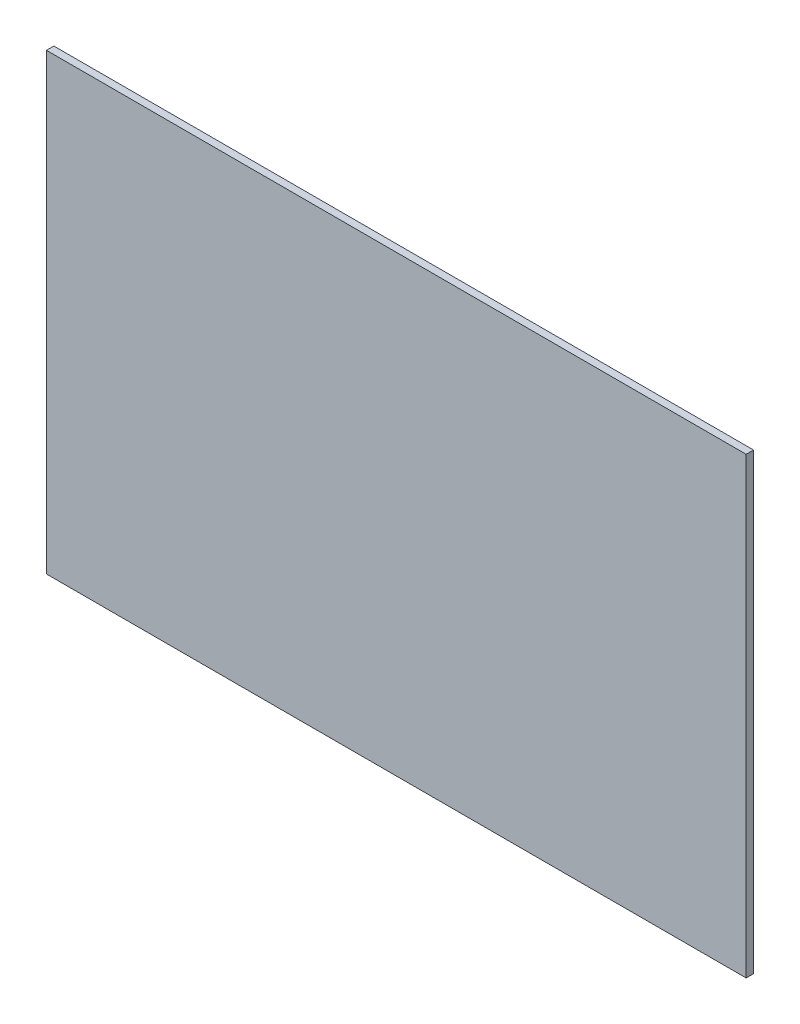
from build123d import *

# Parameters (mm, degrees)
SKETCH1_W           = 299.7
SKETCH1_H           = 194.25
BOSS_EXTRUDE1_DEPTH = 3.175


with BuildPart() as part:
    # Sketch1 → Boss-Extrude1 (new body)
    with BuildSketch(Plane.XY):
        Rectangle(SKETCH1_W, SKETCH1_H)
    extrude(amount=BOSS_EXTRUDE1_DEPTH)


solid = part.part
